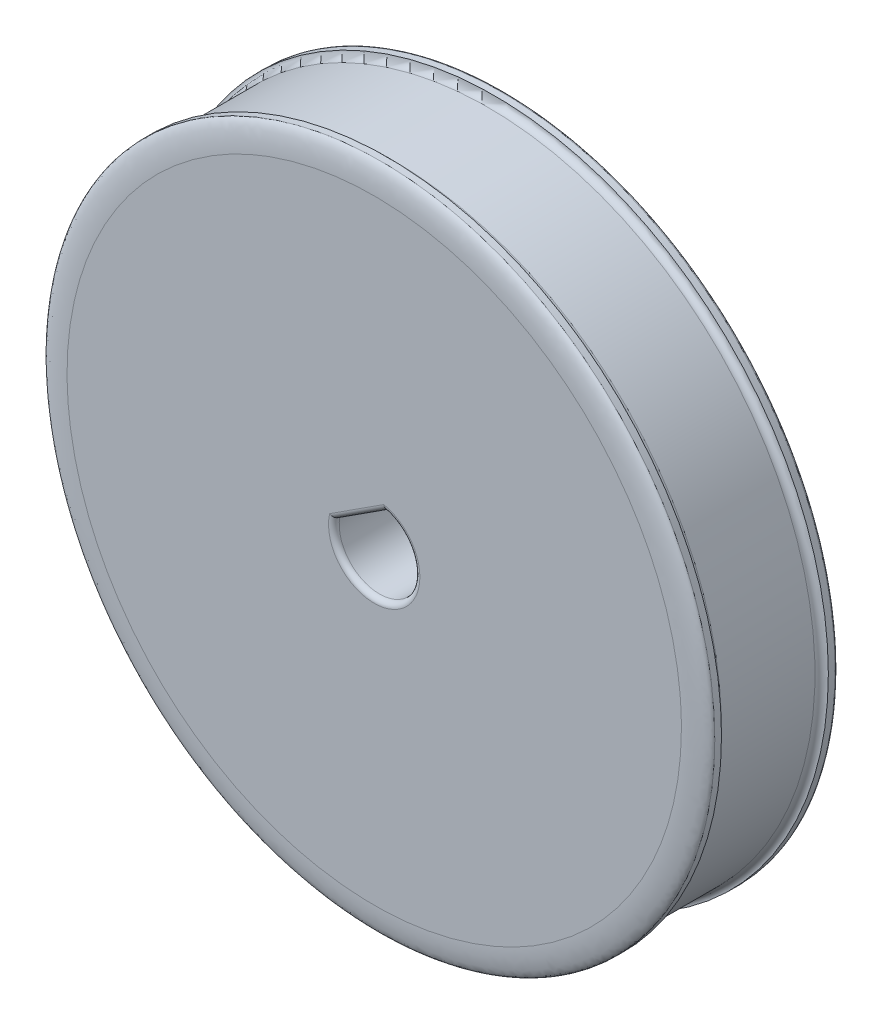
from build123d import *

# Parameters (mm, degrees)
FILLET1_SIZE            = 0.25
FILLET1_SIZE_2          = 1
FILLET2_SIZE            = 0.25
FILLET2_SIZE_2          = 1
SKETCH3_R               = 5
BOSS_EXTRUDE1_DEPTH     = 3.9
FILLET4_R               = 5
FILLET5_R               = 3
CUT_EXTRUDE1_DEPTH      = 19.371173234
CUT_EXTRUDE1_DEPTH_BACK = 19.371173234
FILLET3_R               = 0.2


with BuildPart() as part:
    # Sketch1 → Revolve1 (revolve)
    with BuildSketch(Plane(origin=(0, 0, 0), x_dir=(1, 0, 0), z_dir=(0, 1, 0))):
        with BuildLine():
            Line((-12.5, -2.5), (0, -2.5))
            Line((0, -2.5), (0, 2.5))
            Line((0, 2.5), (-12.5, 2.5))
            Line((-12.5, 2.5), (-12.5, 2))
            ThreePointArc((-12.5, 2), (-12.323223305, 1.926776695), (-12.25, 1.75))
            Line((-12.25, 1.75), (-12.25, -1.75))
            ThreePointArc((-12.25, -1.75), (-12.323223305, -1.926776695), (-12.5, -2))
            Line((-12.5, -2), (-12.5, -2.5))
        make_face()
    revolve(axis=Axis((0, 0, 3.5), (0, 0, 1)))

    # Fillet1
    # an asymmetric fillet: 1, 0.25 mm, written as the material it takes off along each edge
    with BuildSketch(Plane(origin=(0, 0, 2.5), x_dir=(-1, 0, 0), z_dir=(0, 1, 0))) as fillet1_piece_1:
        with BuildLine():
            Bezier((12.5, -FILLET1_SIZE), (12.5, 0), (12.5 - FILLET1_SIZE_2, 0), weights=[1, 0.707106781, 1])
            Line((12.5 - FILLET1_SIZE_2, 0), (12.5, 0))
            Line((12.5, 0), (12.5, -FILLET1_SIZE))
        make_face()
    revolve(axis=Axis((0, 0, 2.5), (0, 0, 1)), mode=Mode.SUBTRACT)

    # Fillet2
    # an asymmetric fillet: 1, 0.25 mm, written as the material it takes off along each edge
    with BuildSketch(Plane(origin=(0, 0, -2.5), x_dir=(-1, 0, 0), z_dir=(0, 1, 0))) as fillet2_piece_1:
        with BuildLine():
            Bezier((12.5, FILLET2_SIZE), (12.5, 0), (12.5 - FILLET2_SIZE_2, 0), weights=[1, 0.707106781, 1])
            Line((12.5 - FILLET2_SIZE_2, 0), (12.5, 0))
            Line((12.5, 0), (12.5, FILLET2_SIZE))
        make_face()
    revolve(axis=Axis((0, 0, -2.5), (0, 0, 1)), mode=Mode.SUBTRACT)

    # Sketch3 → Boss-Extrude1 (add)
    with BuildSketch(Plane(origin=(0, 0, -2.5), x_dir=(-1, 0, 0), z_dir=(0, 0, -1))):
        with Locations(Location((0, 0, 0), (0, 0, 90))):
            Circle(SKETCH3_R)
    extrude(amount=BOSS_EXTRUDE1_DEPTH)

    # Fillet4
    # the kernel refuses this fillet: 5 mm, written as the material it adds along each edge
    with BuildSketch(Plane(origin=(0, 0, -2.5), x_dir=(0, 1, 0), z_dir=(-1, 0, 0))) as fillet4_piece_1:
        with BuildLine():
            CenterArc((9.877499359, 5), FILLET4_R, 192.709032994, 77.290967006)
            Line((5, 3.9), (4.902450013, 3.878))
            ThreePointArc((4.902450013, 3.878), (4.9, 1.95), (4.9, 0))
            Line((4.9, 0), (5, -0.1))
            Line((5, -0.1), (9.877499359, -0.1))
            Line((9.877499359, -0.1), (9.877499359, 0))
        make_face()
    revolve(axis=Axis((0, 0, -2.5), (0, 0, -1)))

    # Fillet5
    fillet5_edges = [part.edges().sort_by_distance(p)[0] for p in [
        (0, -5, -6.4),
    ]]
    fillet(fillet5_edges, radius=FILLET5_R)

    # Sketch2 → Cut-Extrude1 (cut, two sides: drawn at the far end of the back side and taken through both)
    with BuildSketch(Plane(origin=(0, 0, -2.5), x_dir=(-1, 0, 0), z_dir=(0, 0, -1)).offset(-CUT_EXTRUDE1_DEPTH_BACK)):
        with BuildLine():
            Line((-0.394973386, 1.45742788), (1.490895472, 0.239438286))
            ThreePointArc((1.490895472, 0.239438286), (-0.819228886, -1.26844946), (-0.394973386, 1.45742788))
        make_face()
    extrude(amount=CUT_EXTRUDE1_DEPTH + CUT_EXTRUDE1_DEPTH_BACK, mode=Mode.SUBTRACT)

    # Fillet3
    fillet3_edges = [part.edges().sort_by_distance(p)[0] for p in [
        (0.819228886, -1.26844946, 2.5),
        (-0.547961043, 0.848433083, 2.5),
    ]]
    fillet(fillet3_edges, radius=FILLET3_R)


solid = part.part
